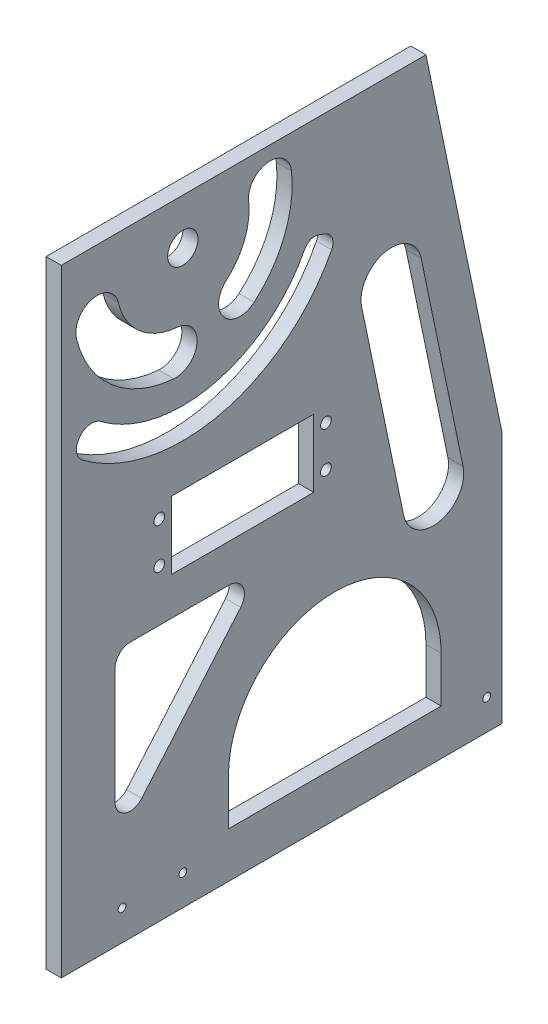
from build123d import *

# Parameters (mm, degrees)
BOSS_EXTRUDE1_DEPTH           = 6.35
SKETCH5_W                     = 184.15
SKETCH5_H                     = 6.35
BOSS_EXTRUDE4_DEPTH           = 31.75
SKETCH6_W                     = 12.7
SKETCH6_H                     = 88.9
CUT_EXTRUDE2_DEPTH            = 270.576010849
CUT_EXTRUDE3_REACH            = 277.64
SKETCH7_R                     = 2.25
SKETCH7_W                     = 59.436
SKETCH7_H                     = 28.313784743
SKETCH8_R                     = 6.35
CUT_EXTRUDE4_DEPTH            = 276.640473489
FILLET1_R                     = 2.54
CONVERT_SOLID1_START          = -34.925
CONVERT_SOLID1_DEPTH          = 184.15
CUT_EXTRUDE5_REACH            = 277.64
CUT_EXTRUDE6_REACH            = 271.576
SKETCH10_R                    = 1.63195
FLAT_PATTERN1_START           = -31.75
FLAT_PATTERN1_DEPTH           = 31.75
FLAT_PATTERN1_2_OUTLINE_R     = 1.63195
FLAT_PATTERN1_2_DEPTH         = 6.35
BODY_MOVE_COPY1_OUTLINE_R     = 1.63195
BODY_MOVE_COPY1_OUTLINE_R_2   = 2.25
BODY_MOVE_COPY1_OUTLINE_W     = 28.313784743
BODY_MOVE_COPY1_OUTLINE_H     = 23.784493131
BODY_MOVE_COPY1_DEPTH         = 6.35
BODY_MOVE_COPY1_2_OUTLINE_R   = 1.63195
BODY_MOVE_COPY1_2_OUTLINE_R_2 = 2.25
BODY_MOVE_COPY1_2_OUTLINE_W   = 28.313784743
BODY_MOVE_COPY1_2_OUTLINE_H   = 23.784493131
BODY_MOVE_COPY1_2_DEPTH       = 6.35


# Read off the part's stored shape, not the designer's step: Convert-Solid1, Flat-Pattern1, Body-Move/Copy1
with BuildPart() as part:
    # Sketch1 → Boss-Extrude1 (new body)
    with BuildSketch(Plane(origin=(0, 0, 0), x_dir=(0, 0, -1), z_dir=(1, 0, 0))):
        with BuildLine():
            Line((-117.475, 228.6), (34.925, 228.6))
            Line((34.925, 228.6), (34.925, 8.89))
            Line((34.925, 8.89), (34.925, 0))
            Line((34.925, 0), (-34.925, 0))
            Line((-34.925, 0), (-34.925, 8.89))
            ThreePointArc((-34.925, 8.89), (-79.375, 53.34), (-123.825, 8.89))
            Line((-123.825, 8.89), (-123.825, 0))
            Line((-123.825, 0), (-149.225, 0))
            Line((-149.225, 0), (-149.225, 76.2))
            Line((-149.225, 76.2), (-117.475, 228.6))
        make_face()
    extrude(amount=BOSS_EXTRUDE1_DEPTH)

    # Sketch5 → Boss-Extrude4 (add)
    with BuildSketch(Plane.ZY):
        with Locations((57.15, 3.175)):
            Rectangle(SKETCH5_W, SKETCH5_H)
    extrude(amount=BOSS_EXTRUDE4_DEPTH)

    # Sketch6 → Cut-Extrude2 (cut, through all)
    with BuildSketch(Plane(origin=(0, 6.35, 0), x_dir=(1, 0, 0), z_dir=(0, 1, 0))):
        with Locations((-6.35, -79.375)):
            Rectangle(SKETCH6_W, SKETCH6_H)
    extrude(amount=-CUT_EXTRUDE2_DEPTH, mode=Mode.SUBTRACT)

    # Sketch7 → Cut-Extrude3 (cut, up to next)
    with BuildSketch(Plane(origin=(6.35, 0, 0), x_dir=(0, 0, -1), z_dir=(1, 0, 0)), mode=Mode.PRIVATE) as cut_extrude3_sk1:
        with Locations((-75.679460058, 116.337237118)):
            Circle(SKETCH7_R)
    cut_extrude3_tool1 = extrude(cut_extrude3_sk1.sketch, amount=-CUT_EXTRUDE3_REACH, mode=Mode.PRIVATE) & part.part
    # Sketch7 → Cut-Extrude3 (cut, up to next)
    with BuildSketch(Plane(origin=(6.35, 0, 0), x_dir=(0, 0, -1), z_dir=(1, 0, 0)), mode=Mode.PRIVATE) as cut_extrude3_sk2:
        with Locations((-75.679460058, 99.360389657)):
            Circle(SKETCH7_R)
    cut_extrude3_tool2 = extrude(cut_extrude3_sk2.sketch, amount=-CUT_EXTRUDE3_REACH, mode=Mode.PRIVATE) & part.part
    # Sketch7 → Cut-Extrude3 (cut, up to next)
    with BuildSketch(Plane(origin=(6.35, 0, 0), x_dir=(0, 0, -1), z_dir=(1, 0, 0)), mode=Mode.PRIVATE) as cut_extrude3_sk3:
        with Locations((-6.03755368, 99.360389657)):
            Circle(SKETCH7_R)
    cut_extrude3_tool3 = extrude(cut_extrude3_sk3.sketch, amount=-CUT_EXTRUDE3_REACH, mode=Mode.PRIVATE) & part.part
    # Sketch7 → Cut-Extrude3 (cut, up to next)
    with BuildSketch(Plane(origin=(6.35, 0, 0), x_dir=(0, 0, -1), z_dir=(1, 0, 0)), mode=Mode.PRIVATE) as cut_extrude3_sk4:
        with Locations((-6.03755368, 116.337237118)):
            Circle(SKETCH7_R)
    cut_extrude3_tool4 = extrude(cut_extrude3_sk4.sketch, amount=-CUT_EXTRUDE3_REACH, mode=Mode.PRIVATE) & part.part
    # Sketch7 → Cut-Extrude3 (cut, up to next)
    with BuildSketch(Plane(origin=(6.35, 0, 0), x_dir=(0, 0, -1), z_dir=(1, 0, 0)), mode=Mode.PRIVATE) as cut_extrude3_sk5:
        with Locations((-40.858506869, 107.848813388)):
            Rectangle(SKETCH7_W, SKETCH7_H)
    cut_extrude3_tool5 = extrude(cut_extrude3_sk5.sketch, amount=-CUT_EXTRUDE3_REACH, mode=Mode.PRIVATE) & part.part
    add(cut_extrude3_tool1.solids().sort_by_distance((6.35, 116.337237, 75.67946))[0], mode=Mode.SUBTRACT)
    add(cut_extrude3_tool2.solids().sort_by_distance((6.35, 99.36039, 75.67946))[0], mode=Mode.SUBTRACT)
    add(cut_extrude3_tool3.solids().sort_by_distance((6.35, 99.36039, 6.037554))[0], mode=Mode.SUBTRACT)
    add(cut_extrude3_tool4.solids().sort_by_distance((6.35, 116.337237, 6.037554))[0], mode=Mode.SUBTRACT)
    add(cut_extrude3_tool5.solids().sort_by_distance((6.35, 107.848813, 40.858507))[0], mode=Mode.SUBTRACT)

    # Sketch8 → Cut-Extrude4 (cut, through all)
    with BuildSketch(Plane(origin=(6.35, 0, 0), x_dir=(0, 0, -1), z_dir=(1, 0, 0))):
        with Locations((-15.875, 209.55)):
            Circle(SKETCH8_R)
    extrude(amount=-CUT_EXTRUDE4_DEPTH, mode=Mode.SUBTRACT)

    # Fillet1
    fillet1_edges = [part.edges().sort_by_distance(p)[0] for p in [
        (0, 6.35, 136.525),
        (0, 6.35, 0),
    ]]
    fillet(fillet1_edges, radius=FILLET1_R)

    # Convert-Solid1 outline → Convert-Solid1 (cut)
    with BuildSketch(Plane.XY.offset(CONVERT_SOLID1_START)):
        with BuildLine():
            ThreePointArc((6.35, 8.89), (3.746179285, 2.603820715), (-2.54, 0))
            Line((-2.54, 0), (6.35, 0))
            Line((6.35, 0), (6.35, 8.89))
        make_face()
    extrude(amount=CONVERT_SOLID1_DEPTH, mode=Mode.SUBTRACT)

    # Sketch9 → Cut-Extrude5 (cut, up to next)
    with BuildSketch(Plane(origin=(6.35, 0, 0), x_dir=(0, 0, -1), z_dir=(1, 0, 0)), mode=Mode.PRIVATE) as cut_extrude5_sk1:
        with BuildLine():
            Line((-75.494212356, 184.752903033), (-73.141435562, 185.731480776))
            ThreePointArc((-73.141435562, 185.731480776), (-69.446832384, 185.812370314), (-66.675, 183.368279277))
            ThreePointArc((-66.675, 183.368279277), (-28.664883279, 153.84953873), (18.415, 163.83))
            ThreePointArc((18.415, 163.83), (27.305, 162.56), (26.035, 153.67))
            ThreePointArc((26.035, 153.67), (-31.616379009, 141.496848075), (-78.066338809, 177.749687467))
            ThreePointArc((-78.066338809, 177.749687467), (-78.311881244, 181.813820193), (-75.494212356, 184.752903033))
        make_face()
    cut_extrude5_tool1 = extrude(cut_extrude5_sk1.sketch, amount=-CUT_EXTRUDE5_REACH, mode=Mode.PRIVATE) & part.part
    # Sketch9 → Cut-Extrude5 (cut, up to next)
    with BuildSketch(Plane(origin=(6.35, 0, 0), x_dir=(0, 0, -1), z_dir=(1, 0, 0)), mode=Mode.PRIVATE) as cut_extrude5_sk2:
        with BuildLine():
            Line((-108.118493719, 66.728864942), (-90.609860799, 150.770302958))
            ThreePointArc((-90.609860799, 150.770302958), (-100.452693102, 165.793573316), (-115.47596346, 155.950741012))
            Line((-115.47596346, 155.950741012), (-132.98459638, 71.909302996))
            ThreePointArc((-132.98459638, 71.909302996), (-123.141764077, 56.886032638), (-108.118493719, 66.728864942))
        make_face()
    cut_extrude5_tool2 = extrude(cut_extrude5_sk2.sketch, amount=-CUT_EXTRUDE5_REACH, mode=Mode.PRIVATE) & part.part
    # Sketch9 → Cut-Extrude5 (cut, up to next)
    with BuildSketch(Plane(origin=(6.35, 0, 0), x_dir=(0, 0, -1), z_dir=(1, 0, 0)), mode=Mode.PRIVATE) as cut_extrude5_sk3:
        with BuildLine():
            Line((-40.087105739, 67.347842772), (1.2905656, 18.917236412))
            ThreePointArc((1.2905656, 18.917236412), (8.316769711, 17.084699632), (12.468452925, 23.041986075))
            Line((12.468452925, 23.041986075), (12.468863596, 71.472592434))
            ThreePointArc((12.468863596, 71.472592434), (10.609010694, 75.962755303), (6.118863596, 77.82264628))
            Line((6.118863596, 77.82264628), (-35.259218414, 77.82264628))
            ThreePointArc((-35.259218414, 77.82264628), (-41.026150106, 74.130652838), (-40.087105739, 67.347842772))
        make_face()
    cut_extrude5_tool3 = extrude(cut_extrude5_sk3.sketch, amount=-CUT_EXTRUDE5_REACH, mode=Mode.PRIVATE) & part.part
    # Sketch9 → Cut-Extrude5 (cut, up to next)
    with BuildSketch(Plane(origin=(6.35, 0, 0), x_dir=(0, 0, -1), z_dir=(1, 0, 0)), mode=Mode.PRIVATE) as cut_extrude5_sk4:
        with BuildLine():
            ThreePointArc((-61.255276679, 214.786351204), (-58.421011662, 192.917929262), (-45.672728213, 174.925091643))
            ThreePointArc((-45.672728213, 174.925091643), (-32.993270754, 175.875161813), (-33.943340924, 188.554619273))
            ThreePointArc((-33.943340924, 188.554619273), (-41.673471553, 199.464871288), (-43.392074603, 212.725147383))
            ThreePointArc((-43.392074603, 212.725147383), (-51.29307373, 222.687350332), (-61.255276679, 214.786351204))
        make_face()
    cut_extrude5_tool4 = extrude(cut_extrude5_sk4.sketch, amount=-CUT_EXTRUDE5_REACH, mode=Mode.PRIVATE) & part.part
    # Sketch9 → Cut-Extrude5 (cut, up to next)
    with BuildSketch(Plane(origin=(6.35, 0, 0), x_dir=(0, 0, -1), z_dir=(1, 0, 0)), mode=Mode.PRIVATE) as cut_extrude5_sk5:
        with BuildLine():
            ThreePointArc((-12.080418407, 164.026489196), (13.963017041, 174.959804504), (28.599113727, 199.117258578))
            ThreePointArc((28.599113727, 199.117258578), (21.899199613, 209.923850348), (11.092607844, 203.223936233))
            ThreePointArc((11.092607844, 203.223936233), (2.217770715, 188.575667985), (-13.574093253, 181.946073037))
            ThreePointArc((-13.574093253, 181.946073037), (-21.787047751, 172.239443693), (-12.080418407, 164.026489196))
        make_face()
    cut_extrude5_tool5 = extrude(cut_extrude5_sk5.sketch, amount=-CUT_EXTRUDE5_REACH, mode=Mode.PRIVATE) & part.part
    add(cut_extrude5_tool1.solids().sort_by_distance((6.35, 181.411079, 77.215324))[0], mode=Mode.SUBTRACT)
    add(cut_extrude5_tool2.solids().sort_by_distance((6.35, 111.339803, 111.797229))[0], mode=Mode.SUBTRACT)
    add(cut_extrude5_tool3.solids().sort_by_distance((6.35, 54.455432, 7.917782))[0], mode=Mode.SUBTRACT)
    add(cut_extrude5_tool4.solids().sort_by_distance((6.35, 197.006846, 47.961274))[0], mode=Mode.SUBTRACT)
    add(cut_extrude5_tool5.solids().sort_by_distance((6.35, 184.385964, -5.831872))[0], mode=Mode.SUBTRACT)

    # Sketch10 → Cut-Extrude6 (cut, up to next)
    with BuildSketch(Plane(origin=(0, 6.35, 0), x_dir=(1, 0, 0), z_dir=(0, 1, 0)), mode=Mode.PRIVATE) as cut_extrude6_sk1:
        with Locations(Location((-19.05, 9.525, 0), (0, 0, 270))):
            Circle(SKETCH10_R)
    cut_extrude6_tool1 = extrude(cut_extrude6_sk1.sketch, amount=-CUT_EXTRUDE6_REACH, mode=Mode.PRIVATE) & part.part
    # Sketch10 → Cut-Extrude6 (cut, up to next)
    with BuildSketch(Plane(origin=(0, 6.35, 0), x_dir=(1, 0, 0), z_dir=(0, 1, 0)), mode=Mode.PRIVATE) as cut_extrude6_sk2:
        with Locations(Location((-19.05, -15.875, 0), (0, 0, 270))):
            Circle(SKETCH10_R)
    cut_extrude6_tool2 = extrude(cut_extrude6_sk2.sketch, amount=-CUT_EXTRUDE6_REACH, mode=Mode.PRIVATE) & part.part
    # Sketch10 → Cut-Extrude6 (cut, up to next)
    with BuildSketch(Plane(origin=(0, 6.35, 0), x_dir=(1, 0, 0), z_dir=(0, 1, 0)), mode=Mode.PRIVATE) as cut_extrude6_sk3:
        with Locations(Location((-19.05, -142.875, 0), (0, 0, 270))):
            Circle(SKETCH10_R)
    cut_extrude6_tool3 = extrude(cut_extrude6_sk3.sketch, amount=-CUT_EXTRUDE6_REACH, mode=Mode.PRIVATE) & part.part
    add(cut_extrude6_tool1.solids().sort_by_distance((-19.05, 6.35, -9.525))[0], mode=Mode.SUBTRACT)
    add(cut_extrude6_tool2.solids().sort_by_distance((-19.05, 6.35, 15.875))[0], mode=Mode.SUBTRACT)
    add(cut_extrude6_tool3.solids().sort_by_distance((-19.05, 6.35, 142.875))[0], mode=Mode.SUBTRACT)

    # Flat-Pattern1 outline → Flat-Pattern1 (cut)
    with BuildSketch(Plane.YZ.offset(FLAT_PATTERN1_START)):
        Polygon((0, 149.225), (0, -34.925), (10, -34.925), (10, 34.925), (6.35, 34.925), (6.35, 123.825), (10, 123.825), (10, 149.225), align=None)
    extrude(amount=FLAT_PATTERN1_DEPTH, mode=Mode.SUBTRACT)

    # Flat-Pattern1 2 outline → Flat-Pattern1 2 (add)
    with BuildSketch(Plane.YZ):
        Polygon((-29.297101008, 149.225), (-29.297101008, -34.925), (10, -34.925), (10, 34.925), (-10.247101008, 34.925), (-10.247101008, 123.825), (10, 123.825), (10, 149.225), align=None)
        with Locations((-16.597101008, -9.525)):
            Circle(FLAT_PATTERN1_2_OUTLINE_R, mode=Mode.SUBTRACT)
        with Locations((-16.597101008, 15.875)):
            Circle(FLAT_PATTERN1_2_OUTLINE_R, mode=Mode.SUBTRACT)
        with Locations((-16.597101008, 142.875)):
            Circle(FLAT_PATTERN1_2_OUTLINE_R, mode=Mode.SUBTRACT)
    extrude(amount=FLAT_PATTERN1_2_DEPTH)

    # Body-Move/Copy1 outline → Body-Move/Copy1 (cut)
    # profile 1 of 14: a face of its own
    with BuildSketch(Plane.YZ):
        with BuildLine():
            Line((-29.297101008, 149.225), (-29.297101008, 34.925))
            Line((-29.297101008, 34.925), (-10.247101008, 34.925))
            Line((-10.247101008, 34.925), (-10.247101008, 123.825))
            Line((-10.247101008, 123.825), (8.89, 123.825))
            ThreePointArc((8.89, 123.825), (53.34, 79.375), (8.89, 34.925))
            Line((8.89, 34.925), (61.305842269, 34.925))
            Line((61.305842269, 34.925), (67.347842772, 40.087105739))
            ThreePointArc((67.347842772, 40.087105739), (74.130652838, 41.026150106), (77.82264628, 35.259218414))
            Line((77.82264628, 35.259218414), (77.82264628, 34.925))
            Line((77.82264628, 34.925), (93.691921016, 34.925))
            Line((93.691921016, 34.925), (93.691921016, 70.576506869))
            Line((93.691921016, 70.576506869), (122.005705759, 70.576506869))
            Line((122.005705759, 70.576506869), (122.005705759, 34.925))
            Line((122.005705759, 34.925), (142.347916699, 34.925))
            ThreePointArc((142.347916699, 34.925), (155.553126259, 60.18481975), (177.749687467, 78.066338809))
            ThreePointArc((177.749687467, 78.066338809), (181.813820193, 78.311881244), (184.752903033, 75.494212356))
            Line((184.752903033, 75.494212356), (185.731480776, 73.141435562))
            ThreePointArc((185.731480776, 73.141435562), (185.812370314, 69.446832384), (183.368279277, 66.675))
            ThreePointArc((183.368279277, 66.675), (166.485549193, 53.445940588), (155.668463274, 34.925))
            Line((155.668463274, 34.925), (174.190576632, 34.925))
            ThreePointArc((174.190576632, 34.925), (172.769914227, 40.421053093), (174.925091643, 45.672728213))
            ThreePointArc((174.925091643, 45.672728213), (192.917929261, 58.421011662), (214.786351204, 61.255276679))
            ThreePointArc((214.786351204, 61.255276679), (222.687350332, 51.29307373), (212.725147383, 43.392074603))
            ThreePointArc((212.725147383, 43.392074603), (200.083693536, 41.906903456), (189.441085171, 34.925))
            Line((189.441085171, 34.925), (228.6, 34.925))
            Line((228.6, 34.925), (228.6, 117.475))
            Line((228.6, 117.475), (76.2, 149.225))
            Line((76.2, 149.225), (-29.297101008, 149.225))
        make_face()
        with Locations((-16.597101008, 142.875)):
            Circle(BODY_MOVE_COPY1_OUTLINE_R, mode=Mode.SUBTRACT)
        with Locations((99.360389657, 75.679460058)):
            Circle(BODY_MOVE_COPY1_OUTLINE_R_2, mode=Mode.SUBTRACT)
        with Locations((116.337237118, 75.679460058)):
            Circle(BODY_MOVE_COPY1_OUTLINE_R_2, mode=Mode.SUBTRACT)
        with BuildLine():
            ThreePointArc((155.950741012, 115.47596346), (165.793573316, 100.452693102), (150.770302958, 90.609860799))
            Line((150.770302958, 90.609860799), (66.728864942, 108.118493719))
            ThreePointArc((66.728864942, 108.118493719), (56.886032638, 123.141764077), (71.909302996, 132.98459638))
            Line((71.909302996, 132.98459638), (155.950741012, 115.47596346))
        make_face(mode=Mode.SUBTRACT)
    # profile 2 of 14: a face of its own
    with BuildSketch(Plane.YZ):
        with BuildLine():
            Line((35.021635432, -12.468554507), (61.305842269, -34.925))
            Line((61.305842269, -34.925), (77.82264628, -34.925))
            Line((77.82264628, -34.925), (77.82264628, -6.118863596))
            ThreePointArc((77.82264628, -6.118863596), (75.962755303, -10.609010694), (71.472592434, -12.468863596))
            Line((71.472592434, -12.468863596), (35.021635432, -12.468554507))
        make_face()
    # profile 3 of 14: a face of its own
    with BuildSketch(Plane.YZ):
        with BuildLine():
            Line((20.427782379, 0), (35.021635432, 12.468554507))
            Line((35.021635432, 12.468554507), (23.041986075, 12.468452925))
            ThreePointArc((23.041986075, 12.468452925), (17.084699632, 8.316769712), (18.917236412, 1.2905656))
            Line((18.917236412, 1.2905656), (20.427782379, 0))
        make_face()
    # profile 4 of 14: a face of its own
    with BuildSketch(Plane.YZ):
        with BuildLine():
            Line((174.190576632, -34.925), (189.441085171, -34.925))
            ThreePointArc((189.441085171, -34.925), (188.991992024, -34.439462386), (188.554619273, -33.943340924))
            ThreePointArc((188.554619273, -33.943340924), (181.126836934, -30.838093338), (174.190576632, -34.925))
        make_face()
    # profile 5 of 14: a face of its own
    with BuildSketch(Plane.YZ):
        with Locations((107.848813388, -23.032753435)):
            Rectangle(BODY_MOVE_COPY1_OUTLINE_W, BODY_MOVE_COPY1_OUTLINE_H)
    # profile 6 of 14: a face of its own
    with BuildSketch(Plane.YZ):
        with BuildLine():
            Line((142.347916699, -34.925), (155.668463274, -34.925))
            ThreePointArc((155.668463274, -34.925), (154.228524049, -30.215739123), (153.199340066, -25.4))
            ThreePointArc((153.199340066, -25.4), (146.080036923, -13.289812481), (141.527894218, 0))
            ThreePointArc((141.527894218, 0), (139.719245783, -17.51459308), (142.347916699, -34.925))
        make_face()
    # profile 7 of 14: a face of its own
    with BuildSketch(Plane.YZ):
        with BuildLine():
            ThreePointArc((153.67, 26.035), (153.433771834, 25.718165742), (153.199340066, 25.4))
            ThreePointArc((153.199340066, 25.4), (152.492867132, 12.618300933), (154.649117721, 0))
            ThreePointArc((154.649117721, 0), (158.403948893, 9.624097163), (163.83, 18.415))
            ThreePointArc((163.83, 18.415), (162.56, 27.305), (153.67, 26.035))
        make_face()
    # profile 8 of 14: a face of its own
    with BuildSketch(Plane.YZ):
        with Locations((-16.597101008, 9.525)):
            Circle(BODY_MOVE_COPY1_OUTLINE_R)
    # profile 9 of 14: a face of its own
    with BuildSketch(Plane.YZ):
        with Locations((-16.597101008, -15.875)):
            Circle(BODY_MOVE_COPY1_OUTLINE_R)
    # profile 10 of 14: a face of its own
    with BuildSketch(Plane.YZ):
        with Locations((99.360389657, -6.03755368)):
            Circle(BODY_MOVE_COPY1_OUTLINE_R_2)
    # profile 11 of 14: a face of its own
    with BuildSketch(Plane.YZ):
        with Locations((116.337237118, -6.03755368)):
            Circle(BODY_MOVE_COPY1_OUTLINE_R_2)
    # profile 12 of 14: a face of its own
    with BuildSketch(Plane.YZ):
        with BuildLine():
            ThreePointArc((209.842819187, -22.218244984), (215.288292733, -13.155717648), (204.825992987, -11.631621895))
            ThreePointArc((204.825992987, -11.631621895), (209.295354914, -15.995672109), (209.842819187, -22.218244984))
        make_face()
    # profile 13 of 14: a face of its own
    with BuildSketch(Plane.YZ):
        with BuildLine():
            ThreePointArc((181.946073037, 13.574093253), (183.498780036, 6.461982735), (186.850763656, 0))
            ThreePointArc((186.850763656, 0), (194.01363946, 7.057345209), (203.223936233, 11.092607844))
            ThreePointArc((203.223936233, 11.092607844), (204.037659695, 11.324382555), (204.825992987, 11.631621895))
            ThreePointArc((204.825992987, 11.631621895), (203.811707267, 18.594282352), (209.842819187, 22.218244984))
            ThreePointArc((209.842819187, 22.218244984), (205.767473994, 27.572720629), (199.117258578, 28.599113727))
            ThreePointArc((199.117258578, 28.599113727), (188.840201826, 24.842234005), (179.751394837, 18.749153646))
            ThreePointArc((179.751394837, 18.749153646), (181.263567923, 16.33754934), (181.946073037, 13.574093253))
        make_face()
    # profile 14 of 14: a face of its own
    with BuildSketch(Plane.YZ):
        with BuildLine():
            ThreePointArc((164.026489196, -12.080418407), (169.475987607, -21.104542637), (179.751394837, -18.749153646))
            ThreePointArc((179.751394837, -18.749153646), (172.043124301, -10.202253703), (166.715746646, 0))
            ThreePointArc((166.715746646, 0), (164.960116069, -5.948714873), (164.026489196, -12.080418407))
        make_face()
    extrude(amount=BODY_MOVE_COPY1_DEPTH, mode=Mode.SUBTRACT)

    # Body-Move_Copy1 2 outline → Body-Move_Copy1 2 (add)
    # profile 1 of 14: a face of its own
    with BuildSketch(Plane.YZ):
        with BuildLine():
            Line((-10.247101008, -34.925), (-29.297101008, -34.925))
            Line((-29.297101008, -34.925), (-29.297101008, -149.225))
            Line((-29.297101008, -149.225), (76.2, -149.225))
            Line((76.2, -149.225), (228.6, -117.475))
            Line((228.6, -117.475), (228.6, -34.925))
            Line((228.6, -34.925), (189.441085171, -34.925))
            ThreePointArc((189.441085171, -34.925), (200.083693536, -41.906903456), (212.725147383, -43.392074603))
            ThreePointArc((212.725147383, -43.392074603), (222.687350332, -51.29307373), (214.786351204, -61.255276679))
            ThreePointArc((214.786351204, -61.255276679), (192.917929261, -58.421011662), (174.925091643, -45.672728213))
            ThreePointArc((174.925091643, -45.672728213), (172.769914227, -40.421053093), (174.190576632, -34.925))
            Line((174.190576632, -34.925), (155.668463274, -34.925))
            ThreePointArc((155.668463274, -34.925), (166.485549193, -53.445940588), (183.368279277, -66.675))
            ThreePointArc((183.368279277, -66.675), (185.812370314, -69.446832384), (185.731480776, -73.141435562))
            Line((185.731480776, -73.141435562), (184.752903033, -75.494212356))
            ThreePointArc((184.752903033, -75.494212356), (181.813820193, -78.311881244), (177.749687467, -78.066338809))
            ThreePointArc((177.749687467, -78.066338809), (155.553126259, -60.18481975), (142.347916699, -34.925))
            Line((142.347916699, -34.925), (122.005705759, -34.925))
            Line((122.005705759, -34.925), (122.005705759, -70.576506869))
            Line((122.005705759, -70.576506869), (93.691921016, -70.576506869))
            Line((93.691921016, -70.576506869), (93.691921016, -34.925))
            Line((93.691921016, -34.925), (77.82264628, -34.925))
            Line((77.82264628, -34.925), (77.82264628, -35.259218414))
            ThreePointArc((77.82264628, -35.259218414), (74.130652838, -41.026150106), (67.347842772, -40.087105739))
            Line((67.347842772, -40.087105739), (61.305842269, -34.925))
            Line((61.305842269, -34.925), (8.89, -34.925))
            ThreePointArc((8.89, -34.925), (53.34, -79.375), (8.89, -123.825))
            Line((8.89, -123.825), (-10.247101008, -123.825))
            Line((-10.247101008, -123.825), (-10.247101008, -34.925))
        make_face()
        with Locations((-16.597101008, -142.875)):
            Circle(BODY_MOVE_COPY1_2_OUTLINE_R, mode=Mode.SUBTRACT)
        with Locations((99.360389657, -75.679460058)):
            Circle(BODY_MOVE_COPY1_2_OUTLINE_R_2, mode=Mode.SUBTRACT)
        with BuildLine():
            ThreePointArc((150.770302958, -90.609860799), (165.793573316, -100.452693102), (155.950741012, -115.47596346))
            Line((155.950741012, -115.47596346), (71.909302996, -132.98459638))
            ThreePointArc((71.909302996, -132.98459638), (56.886032638, -123.141764077), (66.728864942, -108.118493719))
            Line((66.728864942, -108.118493719), (150.770302958, -90.609860799))
        make_face(mode=Mode.SUBTRACT)
        with Locations((116.337237118, -75.679460058)):
            Circle(BODY_MOVE_COPY1_2_OUTLINE_R_2, mode=Mode.SUBTRACT)
    # profile 2 of 14: a face of its own
    with BuildSketch(Plane.YZ):
        with BuildLine():
            Line((77.82264628, 34.925), (61.305842269, 34.925))
            Line((61.305842269, 34.925), (35.021635432, 12.468554507))
            Line((35.021635432, 12.468554507), (71.472592434, 12.468863596))
            ThreePointArc((71.472592434, 12.468863596), (75.962755303, 10.609010694), (77.82264628, 6.118863596))
            Line((77.82264628, 6.118863596), (77.82264628, 34.925))
        make_face()
    # profile 3 of 14: a face of its own
    with BuildSketch(Plane.YZ):
        with BuildLine():
            Line((23.041986075, -12.468452925), (35.021635432, -12.468554507))
            Line((35.021635432, -12.468554507), (20.427782379, 0))
            Line((20.427782379, 0), (18.917236412, -1.2905656))
            ThreePointArc((18.917236412, -1.2905656), (17.084699632, -8.316769712), (23.041986075, -12.468452925))
        make_face()
    # profile 4 of 14: a face of its own
    with BuildSketch(Plane.YZ):
        with Locations((107.848813388, 23.032753435)):
            Rectangle(BODY_MOVE_COPY1_2_OUTLINE_W, BODY_MOVE_COPY1_2_OUTLINE_H)
    # profile 5 of 14: a face of its own
    with BuildSketch(Plane.YZ):
        with BuildLine():
            ThreePointArc((188.554619273, 33.943340924), (188.991992024, 34.439462386), (189.441085171, 34.925))
            Line((189.441085171, 34.925), (174.190576632, 34.925))
            ThreePointArc((174.190576632, 34.925), (181.126836934, 30.838093338), (188.554619273, 33.943340924))
        make_face()
    # profile 6 of 14: a face of its own
    with BuildSketch(Plane.YZ):
        with BuildLine():
            Line((155.668463274, 34.925), (142.347916699, 34.925))
            ThreePointArc((142.347916699, 34.925), (139.719245783, 17.51459308), (141.527894218, 0))
            ThreePointArc((141.527894218, 0), (146.080036923, 13.289812481), (153.199340066, 25.4))
            ThreePointArc((153.199340066, 25.4), (154.228524049, 30.215739123), (155.668463274, 34.925))
        make_face()
    # profile 7 of 14: a face of its own
    with BuildSketch(Plane.YZ):
        with BuildLine():
            ThreePointArc((154.649117721, 0), (152.492867132, -12.618300933), (153.199340066, -25.4))
            ThreePointArc((153.199340066, -25.4), (153.433771834, -25.718165742), (153.67, -26.035))
            ThreePointArc((153.67, -26.035), (162.56, -27.305), (163.83, -18.415))
            ThreePointArc((163.83, -18.415), (158.403948893, -9.624097163), (154.649117721, 0))
        make_face()
    # profile 8 of 14: a face of its own
    with BuildSketch(Plane.YZ):
        with BuildLine():
            ThreePointArc((209.842819187, -22.218244984), (203.811707267, -18.594282352), (204.825992987, -11.631621895))
            ThreePointArc((204.825992987, -11.631621895), (204.037659695, -11.324382555), (203.223936233, -11.092607844))
            ThreePointArc((203.223936233, -11.092607844), (194.01363946, -7.057345209), (186.850763656, 0))
            ThreePointArc((186.850763656, 0), (183.498780036, -6.461982735), (181.946073037, -13.574093253))
            ThreePointArc((181.946073037, -13.574093253), (181.263567923, -16.33754934), (179.751394837, -18.749153646))
            ThreePointArc((179.751394837, -18.749153646), (188.840201826, -24.842234005), (199.117258578, -28.599113727))
            ThreePointArc((199.117258578, -28.599113727), (205.767473994, -27.572720629), (209.842819187, -22.218244984))
        make_face()
    # profile 9 of 14: a face of its own
    with BuildSketch(Plane.YZ):
        with BuildLine():
            ThreePointArc((164.026489196, 12.080418407), (164.960116069, 5.948714873), (166.715746646, 0))
            ThreePointArc((166.715746646, 0), (172.043124301, 10.202253703), (179.751394837, 18.749153646))
            ThreePointArc((179.751394837, 18.749153646), (169.475987607, 21.104542637), (164.026489196, 12.080418407))
        make_face()
    # profile 10 of 14: a face of its own
    with BuildSketch(Plane.YZ):
        with BuildLine():
            ThreePointArc((209.842819187, 22.218244984), (209.295354914, 15.995672109), (204.825992987, 11.631621895))
            ThreePointArc((204.825992987, 11.631621895), (215.288292733, 13.155717648), (209.842819187, 22.218244984))
        make_face()
    # profile 11 of 14: a face of its own
    with BuildSketch(Plane.YZ):
        with Locations((-16.597101008, -9.525)):
            Circle(BODY_MOVE_COPY1_2_OUTLINE_R)
    # profile 12 of 14: a face of its own
    with BuildSketch(Plane.YZ):
        with Locations((-16.597101008, 15.875)):
            Circle(BODY_MOVE_COPY1_2_OUTLINE_R)
    # profile 13 of 14: a face of its own
    with BuildSketch(Plane.YZ):
        with Locations((99.360389657, 6.03755368)):
            Circle(BODY_MOVE_COPY1_2_OUTLINE_R_2)
    # profile 14 of 14: a face of its own
    with BuildSketch(Plane.YZ):
        with Locations((116.337237118, 6.03755368)):
            Circle(BODY_MOVE_COPY1_2_OUTLINE_R_2)
    extrude(amount=BODY_MOVE_COPY1_2_DEPTH)


solid = part.part
